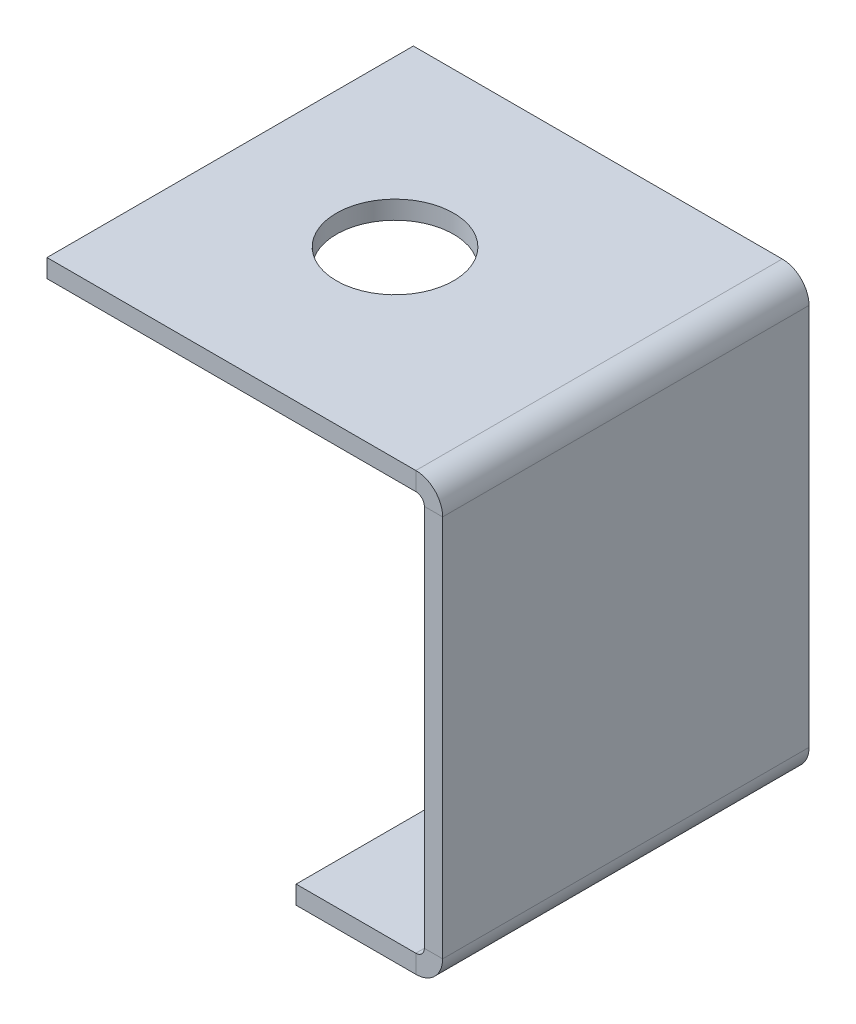
from build123d import *

# Parameters (mm, degrees)
SKETCH1_W                     = 32.7025
SKETCH1_H                     = 31.75
SKETCH1_R                     = 5.08
HV_FUSE_BASE_DEPTH            = 1.5875
FUSE_TO_STACK_STRIP_W         = 7.8232
FUSE_TO_STACK_STRIP_H         = 1.5875
FUSE_TO_STACK_STRIP_CUT_DEPTH = 31.75
FUSE_TO_STACK_DEPTH           = 31.75
STACK_BASE_STRIP_W            = 7.8232
STACK_BASE_STRIP_H            = 1.5875
STACK_BASE_STRIP_CUT_DEPTH    = 31.75
STACK_BASE_DEPTH              = 31.75


# Sheet-metal steps are written as plain solids
with BuildPart() as part:
    # Sketch1 → HV Fuse Base (new body)
    with BuildSketch(Plane(origin=(0, 0, 0), x_dir=(1, 0, 0), z_dir=(0, 1, 0))):
        with Locations((16.35125, -15.875)):
            Rectangle(SKETCH1_W, SKETCH1_H)
        with Locations(Location((14.2875, -15.875, 0), (0, 0, 270))):
            Circle(SKETCH1_R, mode=Mode.SUBTRACT)
    extrude(amount=-HV_FUSE_BASE_DEPTH)

    # Fuse to Stack strip (across the edge) → Fuse to Stack strip cut (cut)
    with BuildSketch(Plane(origin=(32.7025, -1.5875, 0), x_dir=(-1, 0, 0), z_dir=(0, 0, 1))):
        with Locations((-3.175, -0.79375)):
            Rectangle(FUSE_TO_STACK_STRIP_W, FUSE_TO_STACK_STRIP_H)
    extrude(amount=FUSE_TO_STACK_STRIP_CUT_DEPTH, mode=Mode.SUBTRACT)

    # Fuse to Stack section (across the edge) → Fuse to Stack (add)
    with BuildSketch(Plane(origin=(32.7025, -1.5875, 0), x_dir=(-1, 0, 0), z_dir=(0, 0, 1))):
        with BuildLine():
            Line((-1.5875, 0.7366), (-1.5875, 36.22802))
            Line((-1.5875, 36.22802), (0, 36.22802))
            Line((0, 36.22802), (0, 0.7366))
            ThreePointArc((0, 0.7366), (0.215745145, 0.215745145), (0.7366, 0))
            Line((0.7366, 0), (0.7366, -1.5875))
            ThreePointArc((0.7366, -1.5875), (-0.90678687, -0.90678687), (-1.5875, 0.7366))
        make_face()
    extrude(amount=FUSE_TO_STACK_DEPTH)

    # Stack Base strip (across the edge) → Stack Base strip cut (cut)
    with BuildSketch(Plane(origin=(32.7025, -37.81552, 0), x_dir=(0, 1, 0), z_dir=(0, 0, 1))):
        with Locations((-1.5875, -0.79375)):
            Rectangle(STACK_BASE_STRIP_W, STACK_BASE_STRIP_H)
    extrude(amount=STACK_BASE_STRIP_CUT_DEPTH, mode=Mode.SUBTRACT)

    # Stack Base section (across the edge) → Stack Base (add)
    with BuildSketch(Plane(origin=(32.7025, -37.81552, 0), x_dir=(0, 1, 0), z_dir=(0, 0, 1))):
        with BuildLine():
            Line((0, 0.7366), (0, 11.1125))
            Line((0, 11.1125), (1.5875, 11.1125))
            Line((1.5875, 11.1125), (1.5875, 0.7366))
            ThreePointArc((1.5875, 0.7366), (1.803245145, 0.215745145), (2.3241, 0))
            Line((2.3241, 0), (2.3241, -1.5875))
            ThreePointArc((2.3241, -1.5875), (0.68071313, -0.90678687), (0, 0.7366))
        make_face()
    extrude(amount=STACK_BASE_DEPTH)


solid = part.part
